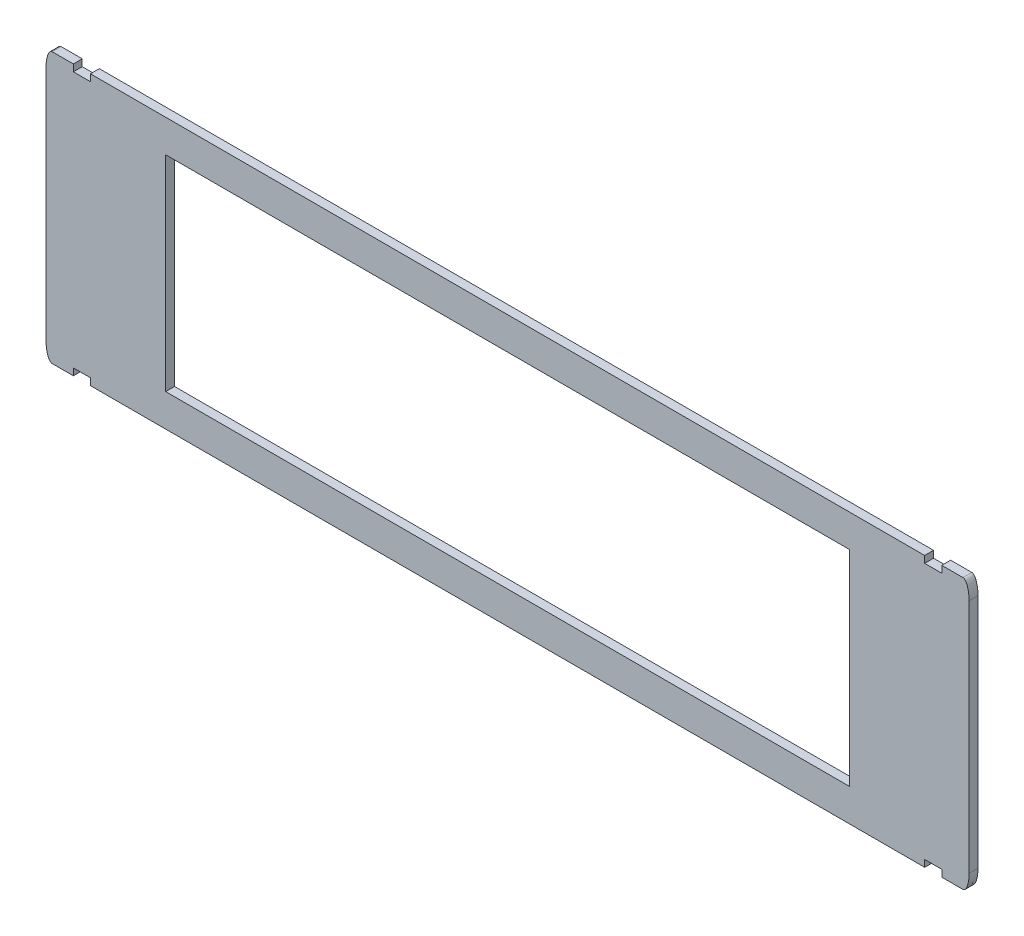
from build123d import *

# Parameters (mm, degrees)
SKETCH_1_W               = 270
SKETCH_1_H               = 79
EXTRUDE_1_DEPTH          = 2.6
SKETCH_2_W               = 200
SKETCH_2_H               = 60
CUT_EXTRUDE_1_DEPTH      = 141.684078701
FILLET_1_SIZE            = 5
FILLET_1_SIZE_2          = 1.8
SKETCH_3_W               = 5
SKETCH_3_H               = 2
CUT_EXTRUDE_2_DEPTH      = 141.684078827
MIRROR_2_COPY_1_SKETCH_W = 5
MIRROR_2_COPY_1_SKETCH_H = 2
MIRROR_2_COPY_1_DEPTH    = 141.684078827


with BuildPart() as part:
    # 草图1 → 凸台-拉伸1 (new body)
    with BuildSketch(Plane.XY):
        Rectangle(SKETCH_1_W, SKETCH_1_H)
    extrude(amount=EXTRUDE_1_DEPTH)

    # 草图2 → 切除-拉伸1 (cut, through all)
    with BuildSketch(Plane.XY.offset(2.6)):
        Rectangle(SKETCH_2_W, SKETCH_2_H)
    extrude(amount=-CUT_EXTRUDE_1_DEPTH, mode=Mode.SUBTRACT)

    # 圆角1
    # an asymmetric fillet: 5, 1.8 mm, written as the material it takes off along each edge
    with BuildSketch(Plane(origin=(135, -39.5, -12.5), x_dir=(0, 1, 0), z_dir=(0, 0, 1))) as fillet_1_piece_1:
        with BuildLine():
            Bezier((FILLET_1_SIZE, 0), (0, 0), (0, FILLET_1_SIZE_2), weights=[1, 0.707106781, 1])
            Line((0, FILLET_1_SIZE_2), (0, 0))
            Line((0, 0), (FILLET_1_SIZE, 0))
        make_face()
    extrude(amount=27.6, mode=Mode.SUBTRACT)
    with BuildSketch(Plane(origin=(135, 39.5, -12.5), x_dir=(-1, 0, 0), z_dir=(0, 0, 1))) as fillet_1_piece_2:
        with BuildLine():
            Bezier((FILLET_1_SIZE_2, 0), (0, 0), (0, FILLET_1_SIZE), weights=[1, 0.707106781, 1])
            Line((0, FILLET_1_SIZE), (0, 0))
            Line((0, 0), (FILLET_1_SIZE_2, 0))
        make_face()
    extrude(amount=27.6, mode=Mode.SUBTRACT)
    with BuildSketch(Plane(origin=(-135, -39.5, -12.5), x_dir=(0, 1, 0), z_dir=(0, 0, 1))) as fillet_1_piece_3:
        with BuildLine():
            Bezier((FILLET_1_SIZE, 0), (0, 0), (0, -FILLET_1_SIZE_2), weights=[1, 0.707106781, 1])
            Line((0, -FILLET_1_SIZE_2), (0, 0))
            Line((0, 0), (FILLET_1_SIZE, 0))
        make_face()
    extrude(amount=27.6, mode=Mode.SUBTRACT)
    with BuildSketch(Plane(origin=(-135, 39.5, -12.5), x_dir=(1, 0, 0), z_dir=(0, 0, 1))) as fillet_1_piece_4:
        with BuildLine():
            Bezier((FILLET_1_SIZE_2, 0), (0, 0), (0, -FILLET_1_SIZE), weights=[1, 0.707106781, 1])
            Line((0, -FILLET_1_SIZE), (0, 0))
            Line((0, 0), (FILLET_1_SIZE_2, 0))
        make_face()
    extrude(amount=27.6, mode=Mode.SUBTRACT)

    # 草图3 → 切除-拉伸2 (cut, through all)
    with BuildSketch(Plane.XY.offset(2.6)):
        with Locations((-124.5, 38.5)):
            Rectangle(SKETCH_3_W, SKETCH_3_H)
    cut_extrude_2 = extrude(amount=-CUT_EXTRUDE_2_DEPTH, mode=Mode.SUBTRACT)

    # 镜向1: 切除-拉伸2 across plane
    add(cut_extrude_2.mirror(Plane.ZX), mode=Mode.SUBTRACT)

    # 镜向2: 切除-拉伸2 across plane
    add(cut_extrude_2.mirror(Plane(origin=(0, 0, 0), x_dir=(0, 0, 1), z_dir=(1, 0, 0))), mode=Mode.SUBTRACT)

    # 镜向2 copy 1 sketch → 镜向2 copy 1 (cut, through all)
    with BuildSketch(Plane(origin=(0, 0, 2.6), x_dir=(-1, 0, 0), z_dir=(0, 0, 1))):
        with Locations((-124.5, 38.5)):
            Rectangle(MIRROR_2_COPY_1_SKETCH_W, MIRROR_2_COPY_1_SKETCH_H)
    extrude(amount=-MIRROR_2_COPY_1_DEPTH, mode=Mode.SUBTRACT)


solid = part.part
